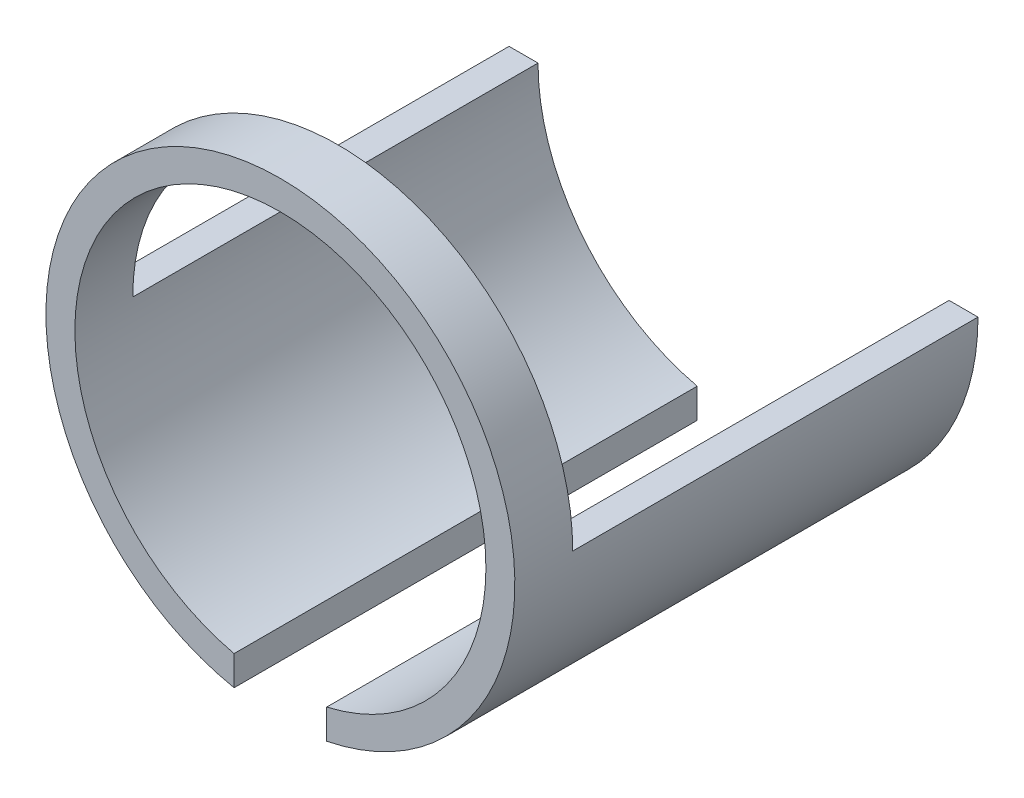
from build123d import *

# Parameters (mm, degrees)
SKETCH_2_R               = 40.5
SKETCH_2_R_2             = 35.5
EXTRUDE_1_DEPTH          = 80
CUT_EXTRUDE_1_DEPTH      = 99.389531964
CUT_EXTRUDE_2_DEPTH      = 99.389531964
CUT_EXTRUDE_2_DEPTH_BACK = 99.389531964
SKETCH_4_W               = 70
SKETCH_4_H               = 40.5


with BuildPart() as part:
    # 草圖2 → 填料-伸長1 (new body)
    with BuildSketch(Plane.XY):
        Circle(SKETCH_2_R)
        Circle(SKETCH_2_R_2, mode=Mode.SUBTRACT)
    extrude(amount=-EXTRUDE_1_DEPTH)

    # 草圖3 → 除料-伸長1 (cut, through all)
    with BuildSketch(Plane.XY):
        with BuildLine():
            Line((8, -34.586847211), (8, -39.702015062))
            ThreePointArc((8, -39.702015062), (0, -40.5), (-8, -39.702015062))
            Line((-8, -39.702015062), (-8, -34.586847211))
            ThreePointArc((-8, -34.586847211), (0, -35.5), (8, -34.586847211))
        make_face()
    extrude(amount=-CUT_EXTRUDE_1_DEPTH, mode=Mode.SUBTRACT)

    # 草圖4 → 除料-伸長2 (cut, two sides: drawn at the far end of the back side and taken through both)
    with BuildSketch(Plane(origin=(0, 0, 0), x_dir=(0, 0, -1), z_dir=(1, 0, 0)).offset(-CUT_EXTRUDE_2_DEPTH_BACK)):
        with Locations((45, 20.25)):
            Rectangle(SKETCH_4_W, SKETCH_4_H)
    extrude(amount=CUT_EXTRUDE_2_DEPTH + CUT_EXTRUDE_2_DEPTH_BACK, mode=Mode.SUBTRACT)


solid = part.part
